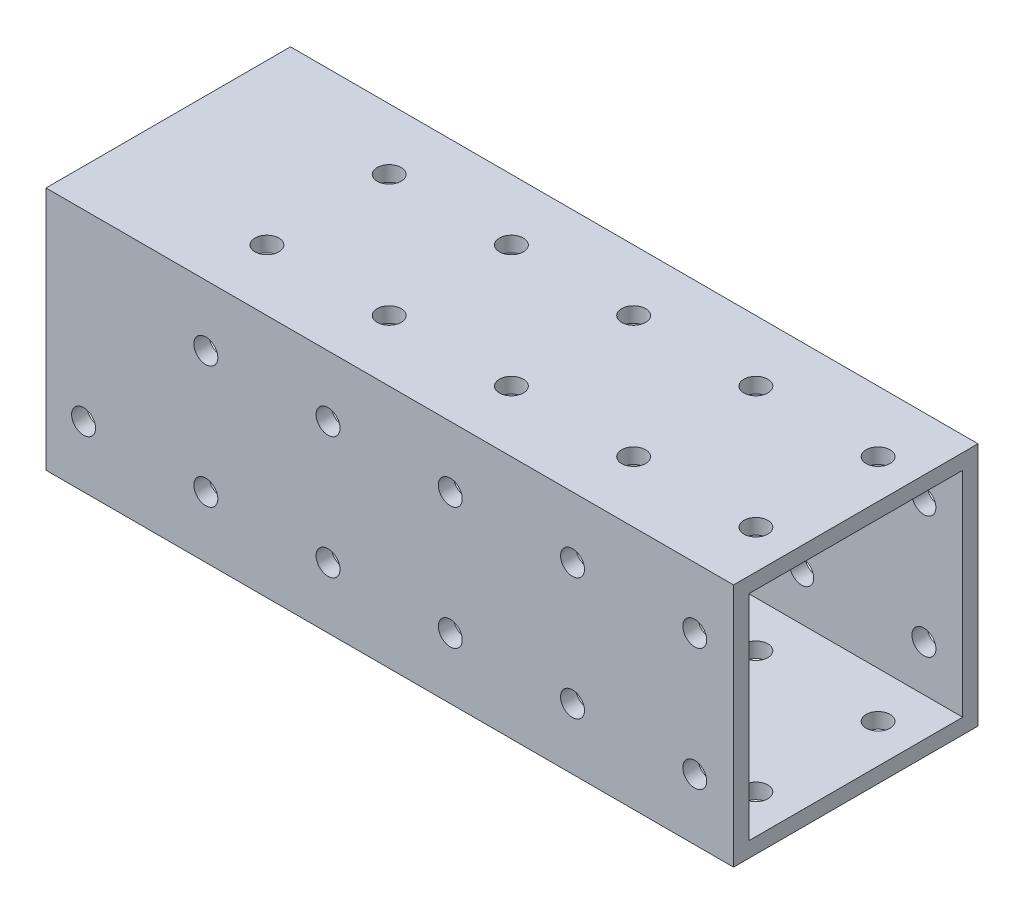
from build123d import *

# Parameters (mm, degrees)
SKETCH1_W           = 50.8
SKETCH1_H           = 50.8
BOSS_EXTRUDE1_DEPTH = 142.875
SHELL1_T            = -3.175
SKETCH2_R           = 2.4892
CUT_EXTRUDE1_DEPTH  = 160.920435295
SKETCH3_R           = 2.4892
CUT_EXTRUDE2_DEPTH  = 160.920435295
LPATTERN1_COUNT     = 5
LPATTERN1_PITCH     = 25.4


with BuildPart() as part:
    # Sketch1 → Boss-Extrude1 (new body)
    with BuildSketch(Plane(origin=(0, 0, 0), x_dir=(0, 0, -1), z_dir=(1, 0, 0))):
        with Locations((25.4, 25.4)):
            Rectangle(SKETCH1_W, SKETCH1_H)
    extrude(amount=BOSS_EXTRUDE1_DEPTH)

    # Shell1
    shell1_openings = [part.faces().sort_by_distance(p)[0] for p in [
        (0, 25.4, -25.4),
        (142.875, 25.4, -25.4),
    ]]
    offset(amount=SHELL1_T, openings=shell1_openings, kind=Kind.INTERSECTION)

    # Sketch2 → Cut-Extrude1 (cut, through all)
    with BuildSketch(Plane(origin=(0, 0, -50.8), x_dir=(-1, 0, 0), z_dir=(0, 0, -1))):
        with Locations((-134.813330442, 38.1)):
            Circle(SKETCH2_R)
        with Locations((-109.413330442, 38.1)):
            Circle(SKETCH2_R)
        with Locations((-84.013330442, 38.1)):
            Circle(SKETCH2_R)
        with Locations((-58.613330442, 38.1)):
            Circle(SKETCH2_R)
        with Locations((-33.213330442, 38.1)):
            Circle(SKETCH2_R)
        with Locations((-33.213330442, 12.7)):
            Circle(SKETCH2_R)
        with Locations((-58.613330442, 12.7)):
            Circle(SKETCH2_R)
        with Locations((-84.013330442, 12.7)):
            Circle(SKETCH2_R)
        with Locations((-109.413330442, 12.7)):
            Circle(SKETCH2_R)
        with Locations((-134.813330442, 12.7)):
            Circle(SKETCH2_R)
        with Locations((-7.813330442, 12.7)):
            Circle(SKETCH2_R)
    extrude(amount=-CUT_EXTRUDE1_DEPTH, mode=Mode.SUBTRACT)

    # Sketch3 → Cut-Extrude2 (cut, through all)
    with BuildSketch(Plane.XZ):
        with Locations((134.813330442, -12.7)):
            Circle(SKETCH3_R)
        with Locations((134.813330442, -38.1)):
            Circle(SKETCH3_R)
    cut_extrude2 = extrude(amount=-CUT_EXTRUDE2_DEPTH, mode=Mode.SUBTRACT)

    # LPattern1: Cut-Extrude2 ×5
    with Locations(*[(-i * LPATTERN1_PITCH, 0, 0) for i in range(1, LPATTERN1_COUNT)]):
        add(cut_extrude2, mode=Mode.SUBTRACT)


solid = part.part
